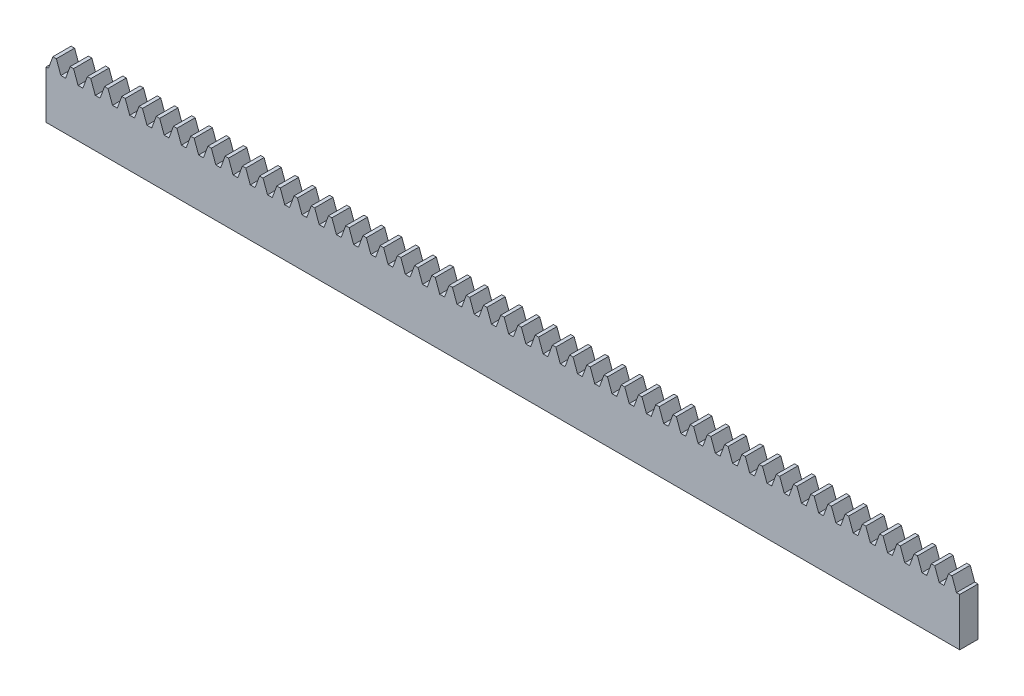
from build123d import *

# Parameters (mm, degrees)
BLANKSKE_W        = 250
BLANKSKE_H        = 16.5
BLANK_DEPTH       = 5
TOOTHCUTSIM_DEPTH = 251.593794815
TEETHCUTS_COUNT   = 55
TEETHCUTS_PITCH   = 4.712388975


with BuildPart() as part:
    # BlankSke → Blank (new body)
    with BuildSketch(Plane.XY):
        with Locations((125, 8.25)):
            Rectangle(BLANKSKE_W, BLANKSKE_H)
    extrude(amount=-BLANK_DEPTH)

    # TooCutSkeSim → ToothCutSim (cut, through all)
    with BuildSketch(Plane.XY):
        Polygon((0.654653055, 13.125), (-0.654653055, 13.125), (-1.975501035, 16.754), (1.975501035, 16.754), align=None)
    toothcutsim = extrude(amount=-TOOTHCUTSIM_DEPTH, mode=Mode.SUBTRACT)

    # TeethCuts: ToothCutSim ×55
    with Locations(*[(i * TEETHCUTS_PITCH, 0, 0) for i in range(1, TEETHCUTS_COUNT)]):
        add(toothcutsim, mode=Mode.SUBTRACT)


solid = part.part
